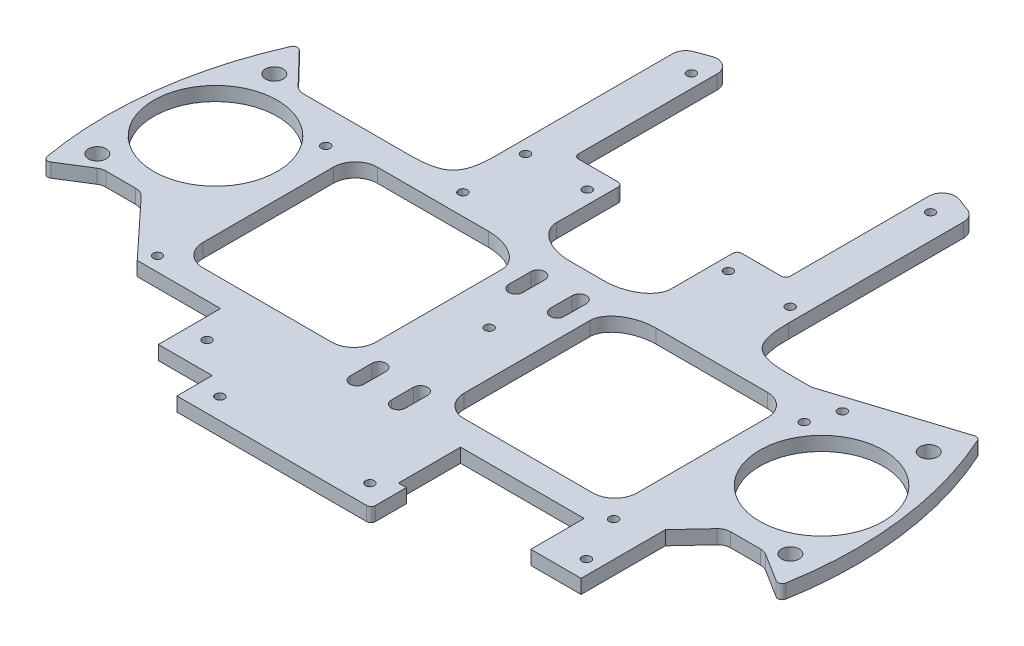
from build123d import *

# Parameters (mm, degrees)
SKETCH1_R                = 85
BOSS_EXTRUDE1_DEPTH      = 3.175
CUT_EXTRUDE1_DEPTH       = 121.250075364
CUT_EXTRUDE2_DEPTH       = 121.250075364
SKETCH4_R                = 14
CUT_EXTRUDE3_DEPTH       = 118.830728696
SKETCH5_R                = 1
CUT_EXTRUDE4_DEPTH       = 118.830728696
SKETCH6_R                = 2
CUT_EXTRUDE5_DEPTH       = 118.830728696
SKETCH7_R                = 1
CUT_EXTRUDE6_DEPTH       = 118.830728696
SKETCH8_R                = 1
CUT_EXTRUDE7_DEPTH       = 118.830728696
CUT_EXTRUDE8_DEPTH       = 118.830728696
CUT_EXTRUDE9_DEPTH       = 10
CUT_EXTRUDE9_DEPTH_BACK  = 118.830728696
SKETCH11_R               = 1
SKETCH12_R               = 1
CUT_EXTRUDE10_DEPTH      = 118.830728696
SKETCH13_W               = 39.185297029
SKETCH13_H               = 39.537245231
CUT_EXTRUDE11_DEPTH      = 118.830728696
SKETCH14_R               = 1
CUT_EXTRUDE12_DEPTH      = 118.830728696
FILLET1_R                = 3
FILLET2_R                = 1
FILLET3_SIZE             = 9
FILLET3_SIZE_2           = 6
FILLET4_SIZE             = 10
FILLET5_R                = 5
CUT_EXTRUDE13_DEPTH      = 118.062568615
CUT_EXTRUDE13_DEPTH_BACK = 118.062568615
SKETCH23_R               = 1


with BuildPart() as part:
    # Sketch1 → Boss-Extrude1 (new body)
    with BuildSketch(Plane(origin=(0, 0, 0), x_dir=(1, 0, 0), z_dir=(0, 1, 0))):
        with Locations(Location((0, 0, 0), (0, 0, 270))):
            Circle(SKETCH1_R)
    extrude(amount=BOSS_EXTRUDE1_DEPTH)

    # Sketch2 → Cut-Extrude1 (cut, through all)
    with BuildSketch(Plane(origin=(0, 3.175, 0), x_dir=(1, 0, 0), z_dir=(0, 1, 0))):
        with BuildLine():
            Line((24, 45), (24, 81.541400528))
            ThreePointArc((24, 81.541400528), (0, 85), (-24, 81.541400528))
            Line((-24, 81.541400528), (-24, 45))
            Line((-24, 45), (-13, 45))
            Line((-13, 45), (-13, 24))
            Line((-13, 24), (13, 24))
            Line((13, 24), (13, 45))
            Line((13, 45), (24, 45))
        make_face()
    extrude(amount=-CUT_EXTRUDE1_DEPTH, mode=Mode.SUBTRACT)

    # Sketch3 → Cut-Extrude2 (cut, through all)
    with BuildSketch(Plane(origin=(0, 3.175, 0), x_dir=(1, 0, 0), z_dir=(0, 1, 0))):
        with BuildLine():
            Line((46, -64.226162893), (46, -47))
            Line((46, -47), (-54, -47))
            Line((-54, -47), (-54, -65.642973729))
            ThreePointArc((-54, -65.642973729), (-4.950732336, -84.855702515), (46, -71.477269114))
            Line((46, -71.477269114), (46, -64.226162893))
        make_face()
        with BuildLine():
            Line((63.498031466, -47), (46, -47))
            Line((46, -47), (46, -64.226162893))
            ThreePointArc((46, -64.226162893), (55.422377211, -56.297070122), (63.498031466, -47))
        make_face()
    extrude(amount=-CUT_EXTRUDE2_DEPTH, mode=Mode.SUBTRACT)

    # Sketch4 → Cut-Extrude3 (cut, through all)
    with BuildSketch(Plane(origin=(0, 3.175, 0), x_dir=(1, 0, 0), z_dir=(0, 1, 0))):
        with Locations(Location((-68.685297029, 8.424367751, 0), (0, 0, 270))):
            Circle(SKETCH4_R)
        with Locations(Location((68.685297029, 8.424367751, 0), (0, 0, 270))):
            Circle(SKETCH4_R)
    extrude(amount=-CUT_EXTRUDE3_DEPTH, mode=Mode.SUBTRACT)

    # Sketch5 → Cut-Extrude4 (cut, through all)
    with BuildSketch(Plane(origin=(0, 3.175, 0), x_dir=(1, 0, 0), z_dir=(0, 1, 0))):
        with Locations(Location((-54.205297029, 18.944367751, 0), (0, 0, 270))):
            Circle(SKETCH5_R)
        with Locations(Location((-51.703295689, -21.695632249, 0), (0, 0, 270))):
            Circle(SKETCH5_R)
        with Locations(Location((0.004702971, 1.774367751, 0), (0, 0, 270))):
            Circle(SKETCH5_R)
        with Locations(Location((51.674702971, -21.695632249, 0), (0, 0, 270))):
            Circle(SKETCH5_R)
        with Locations(Location((54.214702971, 18.944367751, 0), (0, 0, 270))):
            Circle(SKETCH5_R)
    extrude(amount=-CUT_EXTRUDE4_DEPTH, mode=Mode.SUBTRACT)

    # Sketch6 → Cut-Extrude5 (cut, through all)
    with BuildSketch(Plane(origin=(0, 3.175, 0), x_dir=(1, 0, 0), z_dir=(0, 1, 0))):
        with Locations(Location((74.158590171, 27.230561946, 0), (0, 0, 270))):
            Circle(SKETCH6_R)
        with Locations(Location((78.541209232, -8.501673503, 0), (0, 0, 270))):
            Circle(SKETCH6_R)
        with Locations(Location((-78.541209232, -8.501673503, 0), (0, 0, 90))):
            Circle(SKETCH6_R)
        with Locations(Location((-74.158590171, 27.230561946, 0), (0, 0, 90))):
            Circle(SKETCH6_R)
    extrude(amount=-CUT_EXTRUDE5_DEPTH, mode=Mode.SUBTRACT)

    # Sketch7 → Cut-Extrude6 (cut, through all)
    with BuildSketch(Plane(origin=(0, 3.175, 0), x_dir=(1, 0, 0), z_dir=(0, 1, 0))):
        with Locations(Location((-17, -42.25, 0), (0, 0, 270))):
            Circle(SKETCH7_R)
        with Locations(Location((17, -42.25, 0), (0, 0, 270))):
            Circle(SKETCH7_R)
    extrude(amount=-CUT_EXTRUDE6_DEPTH, mode=Mode.SUBTRACT)

    # Sketch8 → Cut-Extrude7 (cut, through all)
    with BuildSketch(Plane(origin=(0, 3.175, 0), x_dir=(1, 0, 0), z_dir=(0, 1, 0))):
        with Locations(Location((-44.228070355, 47.187129244, 0), (0, 0, 270))):
            Circle(SKETCH8_R)
        with Locations(Location((-55.025439175, 36.774789135, 0), (0, 0, 270))):
            Circle(SKETCH8_R)
        with Locations(Location((-54.744489626, -35.3653201, 0), (0, 0, 270))):
            Circle(SKETCH8_R)
        with Locations(Location((-62.705485942, -22.652234807, 0), (0, 0, 270))):
            Circle(SKETCH8_R)
        with Locations(Location((62.705485942, -22.652234807, 0), (0, 0, 90))):
            Circle(SKETCH8_R)
        with Locations(Location((55.025439175, 36.774789135, 0), (0, 0, 90))):
            Circle(SKETCH8_R)
        with Locations(Location((44.228070355, 47.187129244, 0), (0, 0, 90))):
            Circle(SKETCH8_R)
    extrude(amount=-CUT_EXTRUDE7_DEPTH, mode=Mode.SUBTRACT)

    # Sketch9 → Cut-Extrude8 (cut, through all)
    with BuildSketch(Plane(origin=(0, 3.175, 0), x_dir=(1, 0, 0), z_dir=(0, 1, 0))):
        with BuildLine():
            Line((-3.1, 17.5), (-3.1, 12.5))
            ThreePointArc((-3.1, 12.5), (-4.7, 10.9), (-6.3, 12.5))
            Line((-6.3, 12.5), (-6.3, 17.5))
            ThreePointArc((-6.3, 17.5), (-4.7, 19.1), (-3.1, 17.5))
        make_face()
        with BuildLine():
            Line((6.3, 17.5), (6.3, 12.5))
            ThreePointArc((6.3, 12.5), (4.7, 10.9), (3.1, 12.5))
            Line((3.1, 12.5), (3.1, 17.5))
            ThreePointArc((3.1, 17.5), (4.7, 19.1), (6.3, 17.5))
        make_face()
        with BuildLine():
            Line((-6.3, -23.5), (-6.3, -18.5))
            ThreePointArc((-6.3, -18.5), (-4.7, -16.9), (-3.1, -18.5))
            Line((-3.1, -18.5), (-3.1, -23.5))
            ThreePointArc((-3.1, -23.5), (-4.7, -25.1), (-6.3, -23.5))
        make_face()
        with BuildLine():
            Line((3.1, -23.5), (3.1, -18.5))
            ThreePointArc((3.1, -18.5), (4.7, -16.9), (6.3, -18.5))
            Line((6.3, -18.5), (6.3, -23.5))
            ThreePointArc((6.3, -23.5), (4.7, -25.1), (3.1, -23.5))
        make_face()
    extrude(amount=-CUT_EXTRUDE8_DEPTH, mode=Mode.SUBTRACT)

    # Sketch11 → Cut-Extrude9 (cut, two sides: drawn at the far end of the back side and taken through both)
    # profile 1 of 4: a face of its own
    with BuildSketch(Plane(origin=(0, 3.175, 0), x_dir=(1, 0, 0), z_dir=(0, 1, 0)).offset(-CUT_EXTRUDE9_DEPTH_BACK)):
        with BuildLine():
            Line((-33, 26.630858487), (-33, 78.33262411))
            ThreePointArc((-33, 78.33262411), (-58.995216162, 61.192846559), (-77.073860284, 35.841596796))
            Line((-77.073860284, 35.841596796), (-68.191572245, 26.630858487))
            Line((-68.191572245, 26.630858487), (-33, 26.630858487))
        make_face()
        with Locations((-55.025439175, 36.774789135)):
            Circle(SKETCH11_R, mode=Mode.SUBTRACT)
        with Locations((-44.228070355, 47.187129244)):
            Circle(SKETCH11_R, mode=Mode.SUBTRACT)
    # profile 2 of 4: a face of its own
    with BuildSketch(Plane(origin=(0, 3.175, 0), x_dir=(1, 0, 0), z_dir=(0, 1, 0)).offset(-CUT_EXTRUDE9_DEPTH_BACK)):
        with BuildLine():
            Line((-75.072742311, -10.906386744), (-83.451078309, -16.152941807))
            ThreePointArc((-83.451078309, -16.152941807), (-73.044613402, -43.46820048), (-54, -65.642973729))
            Line((-54, -65.642973729), (-54, -47))
            Line((-54, -47), (-22, -47))
            Line((-22, -47), (-22, -39))
            Line((-22, -39), (-34.205297029, -39))
            Line((-34.205297029, -39), (-34.205297029, -24.906386744))
            Line((-34.205297029, -24.906386744), (-53.091478023, -24.906386744))
            Line((-53.091478023, -24.906386744), (-66.121719331, -10.906386744))
            Line((-66.121719331, -10.906386744), (-75.072742311, -10.906386744))
        make_face()
        with Locations((-54.744489626, -35.3653201)):
            Circle(SKETCH11_R, mode=Mode.SUBTRACT)
        with Locations((-62.705485942, -22.652234807)):
            Circle(SKETCH11_R, mode=Mode.SUBTRACT)
    # profile 3 of 4: a face of its own
    with BuildSketch(Plane(origin=(0, 3.175, 0), x_dir=(1, 0, 0), z_dir=(0, 1, 0)).offset(-CUT_EXTRUDE9_DEPTH_BACK)):
        with BuildLine():
            Line((22, -39), (22, -47))
            Line((22, -47), (63.498031466, -47))
            ThreePointArc((63.498031466, -47), (55.422377211, -56.297070122), (46, -64.226162893))
            Line((46, -64.226162893), (46, -71.477269114))
            ThreePointArc((46, -71.477269114), (70.388853641, -47.648811981), (83.451078309, -16.152941807))
            Line((83.451078309, -16.152941807), (75.072742311, -10.906386744))
            Line((75.072742311, -10.906386744), (66.121719331, -10.906386744))
            Line((66.121719331, -10.906386744), (59.606598677, -17.906386744))
            Line((59.606598677, -17.906386744), (59.606598677, -37))
            Line((59.606598677, -37), (48.205297029, -37))
            Line((48.205297029, -37), (48.205297029, -24.906386744))
            Line((48.205297029, -24.906386744), (20.205297029, -24.906386744))
            Line((20.205297029, -24.906386744), (20.205297029, -39))
            Line((20.205297029, -39), (22, -39))
        make_face()
        with Locations((62.705485942, -22.652234807)):
            Circle(SKETCH11_R, mode=Mode.SUBTRACT)
    # profile 4 of 4: a face of its own
    with BuildSketch(Plane(origin=(0, 3.175, 0), x_dir=(1, 0, 0), z_dir=(0, 1, 0)).offset(-CUT_EXTRUDE9_DEPTH_BACK)):
        with BuildLine():
            ThreePointArc((77.073860284, 35.841596796), (58.995216162, 61.192846559), (33, 78.33262411))
            Line((33, 78.33262411), (33, 26.630858487))
            Line((33, 26.630858487), (48.205297029, 26.630858487))
            Line((48.205297029, 26.630858487), (77.073860284, 35.841596796))
        make_face()
        with Locations((55.025439175, 36.774789135)):
            Circle(SKETCH11_R, mode=Mode.SUBTRACT)
        with Locations((44.228070355, 47.187129244)):
            Circle(SKETCH11_R, mode=Mode.SUBTRACT)
    extrude(amount=CUT_EXTRUDE9_DEPTH + CUT_EXTRUDE9_DEPTH_BACK, mode=Mode.SUBTRACT)

    # Sketch12 → Cut-Extrude10 (cut, through all)
    with BuildSketch(Plane(origin=(0, 3.175, 0), x_dir=(1, 0, 0), z_dir=(0, 1, 0))):
        with Locations(Location((-27, 74.597766718, 0), (0, 0, 270))):
            Circle(SKETCH12_R)
        with Locations(Location((27.361579834, 74.452925447, 0), (0, 0, 270))):
            Circle(SKETCH12_R)
    extrude(amount=-CUT_EXTRUDE10_DEPTH, mode=Mode.SUBTRACT)

    # Sketch13 → Cut-Extrude11 (cut, through all)
    with BuildSketch(Plane(origin=(0, 3.175, 0), x_dir=(1, 0, 0), z_dir=(0, 1, 0))):
        with Locations((-29.592648515, 0.862235871)):
            Rectangle(SKETCH13_W, SKETCH13_H)
        with Locations((29.592648515, 0.862235871)):
            Rectangle(SKETCH13_W, SKETCH13_H)
    extrude(amount=-CUT_EXTRUDE11_DEPTH, mode=Mode.SUBTRACT)

    # Sketch14 → Cut-Extrude12 (cut, through all)
    with BuildSketch(Plane(origin=(0, 3.175, 0), x_dir=(1, 0, 0), z_dir=(0, 1, 0))):
        with Locations(Location((-30, 40, 0), (0, 0, 270))):
            Circle(SKETCH14_R)
        with Locations(Location((30, 40, 0), (0, 0, 90))):
            Circle(SKETCH14_R)
        with Locations(Location((-16, 40, 0), (0, 0, 90))):
            Circle(SKETCH14_R)
        with Locations(Location((16, 40, 0), (0, 0, 270))):
            Circle(SKETCH14_R)
    extrude(amount=-CUT_EXTRUDE12_DEPTH, mode=Mode.SUBTRACT)

    # Fillet1
    fillet1_edges = [part.edges().sort_by_distance(p)[0] for p in [
        (-24, 1.5875, -81.541400528),
        (24, 1.5875, -81.541400528),
        (48.205297029, 1.5875, -26.630858487),
        (33, 1.5875, -78.33262411),
        (-75.072742311, 1.5875, 10.906386744),
        (-66.121719331, 1.5875, 10.906386744),
        (66.121719331, 1.5875, 10.906386744),
        (75.072742311, 1.5875, 10.906386744),
        (-68.191572245, 1.5875, -26.630858487),
        (-33, 1.5875, -78.33262411),
    ]]
    fillet(fillet1_edges, radius=FILLET1_R)

    # Fillet2
    fillet2_edges = [part.edges().sort_by_distance(p)[0] for p in [
        (24, 1.5875, -45),
        (13, 1.5875, -45),
        (22, 1.5875, 47),
        (-13, 1.5875, -45),
        (-24, 1.5875, -45),
        (77.073860284, 1.5875, -35.841596796),
        (-83.451078309, 1.5875, 16.152941807),
        (83.451078309, 1.5875, 16.152941807),
        (-77.073860284, 1.5875, -35.841596796),
    ]]
    fillet(fillet2_edges, radius=FILLET2_R)

    # Fillet3
    # a fillet whose section is not a circle: 9, 6 mm, written as the material it adds along each edge
    with BuildSketch(Plane(origin=(10, 3.175, -20.630858487), x_dir=(1, 0, 0), z_dir=(0, -1, 0)), Plane(origin=(13, 3.175, -24), x_dir=(-1, 0, 0), z_dir=(0, -1, 0))) as fillet3_piece_1:
        with BuildLine():
            Bezier((FILLET3_SIZE, 0), (0, 0), (0, FILLET3_SIZE_2), weights=[1, 0.666666667, 1])
            Line((0, FILLET3_SIZE_2), (0, 0))
            Line((0, 0), (FILLET3_SIZE, 0))
        make_face()
    extrude(amount=3.175)
    with BuildSketch(Plane(origin=(-10, 3.175, -20.630858487), x_dir=(0, 0, 1), z_dir=(0, -1, 0)), Plane(origin=(-13, 3.175, -24), x_dir=(0, 0, -1), z_dir=(0, -1, 0))) as fillet3_piece_2:
        with BuildLine():
            Bezier((FILLET3_SIZE_2, 0), (0, 0), (0, FILLET3_SIZE), weights=[1, 0.666666667, 1])
            Line((0, FILLET3_SIZE), (0, 0))
            Line((0, 0), (FILLET3_SIZE_2, 0))
        make_face()
    extrude(amount=3.175)

    # Fillet4
    # a fillet whose section is not a circle: 10 mm, written as the material it adds along each edge
    with BuildSketch(Plane(origin=(-33, 0, -26.630858487), x_dir=(-1, 0, 0), z_dir=(0, 1, 0)), Plane(origin=(33, 0, -26.630858487), x_dir=(0, 0, -1), z_dir=(0, 1, 0))) as fillet4_piece_1:
        with BuildLine():
            Bezier((FILLET4_SIZE, 0), (0, 0), (0, -FILLET4_SIZE), weights=[1, 1.5, 1])
            Line((0, -FILLET4_SIZE), (0, 0))
            Line((0, 0), (FILLET4_SIZE, 0))
        make_face()
    extrude(amount=3.175)

    # Fillet5
    fillet5_edges = [part.edges().sort_by_distance(p)[0] for p in [
        (49.185297029, 1.5875, -20.630858487),
        (49.185297029, 1.5875, 18.906386744),
        (10, 1.5875, 18.906386744),
        (-10, 1.5875, 18.906386744),
        (-49.185297029, 1.5875, 18.906386744),
        (-49.185297029, 1.5875, -20.630858487),
    ]]
    fillet(fillet5_edges, radius=FILLET5_R)

    # Sketch23 → Cut-Extrude13 (cut, two sides: drawn at the far end of the back side and taken through both)
    with BuildSketch(Plane(origin=(0, 0, 0), x_dir=(1, 0, 0), z_dir=(0, 1, 0)).offset(-CUT_EXTRUDE13_DEPTH_BACK)):
        with Locations(Location((56.441544134, 25.380858487, 0), (0, 0, 270))):
            Circle(SKETCH23_R)
        with Locations(Location((-29.558455866, -32.619141513, 0), (0, 0, 270))):
            Circle(SKETCH23_R)
        with Locations(Location((-29.558455866, 25.380858487, 0), (0, 0, 270))):
            Circle(SKETCH23_R)
        with Locations(Location((56.441544134, -32.619141513, 0), (0, 0, 270))):
            Circle(SKETCH23_R)
    extrude(amount=CUT_EXTRUDE13_DEPTH + CUT_EXTRUDE13_DEPTH_BACK, mode=Mode.SUBTRACT)


solid = part.part
